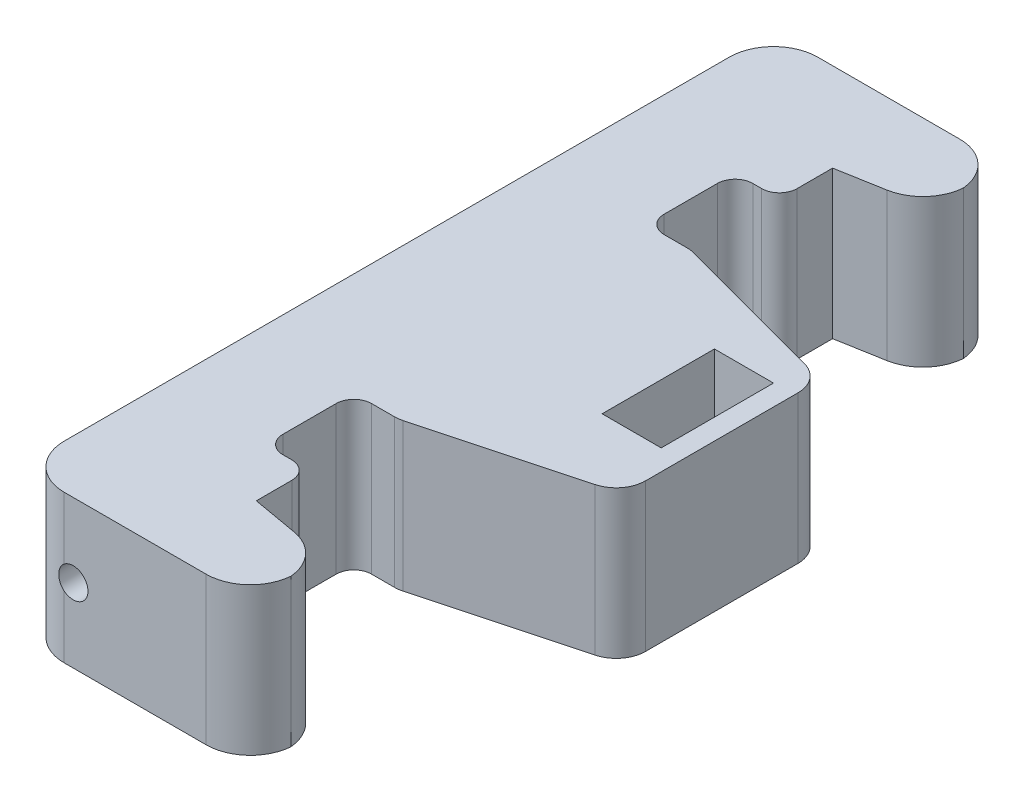
from build123d import *

# Parameters (mm, degrees)
BOSS_EXTRUDE1_DEPTH = 12.7
CUT_EXTRUDE1_DEPTH  = 38.486519244
FILLET4_R           = 1.524
FILLET5_R           = 3.81
SKETCH3_R           = 1.27
CUT_EXTRUDE2_DEPTH  = 68.465574925
SKETCH4_W           = 5.08
SKETCH4_H           = 9.652
CUT_EXTRUDE3_DEPTH  = 38.486519401
FILLET6_R           = 2.54


with BuildPart() as part:
    # Sketch1 → Boss-Extrude1 (new body)
    with BuildSketch(Plane(origin=(0, 0, 0), x_dir=(1, 0, 0), z_dir=(0, 1, 0))):
        Polygon((5.842, 32.385), (-13.97, 32.385), (-13.97, -32.385), (5.842, -32.385), (5.842, -24.765), (-1.27, -24.765), (-1.27, -20.193), (-5.08, -20.193), (-5.08, -12.573), (-1.27, -12.573), (5.842, -12.573), (13.97, -12.573), (13.97, 12.573), (5.842, 12.573), (-1.27, 12.573), (-5.08, 12.573), (-5.08, 20.193), (-1.27, 20.193), (-1.27, 24.765), (5.842, 24.765), align=None)
    extrude(amount=BOSS_EXTRUDE1_DEPTH)

    # Sketch2 → Cut-Extrude1 (cut, through all)
    with BuildSketch(Plane(origin=(0, 12.7, 0), x_dir=(1, 0, 0), z_dir=(0, 1, 0))):
        Polygon((-1.27, 24.765), (5.842, 26.019037487), (5.842, 24.765), align=None)
        Polygon((-1.27, -24.765), (5.842, -26.019037487), (5.842, -24.765), align=None)
        Polygon((-1.27, 12.573), (13.97, 8.489454307), (13.97, 12.573), align=None)
        Polygon((-1.27, -12.573), (13.97, -8.489454307), (13.97, -12.573), align=None)
    extrude(amount=-CUT_EXTRUDE1_DEPTH, mode=Mode.SUBTRACT)

    # Fillet4
    fillet4_edges = [part.edges().sort_by_distance(p)[0] for p in [
        (-5.08, 6.35, 20.193),
        (-1.27, 6.35, 20.193),
        (-1.27, 6.35, -20.193),
        (-5.08, 6.35, -20.193),
        (-5.08, 6.35, -12.573),
        (-5.08, 6.35, 12.573),
    ]]
    fillet(fillet4_edges, radius=FILLET4_R)

    # Fillet5
    # the kernel refuses this fillet: 3.81 mm, written as the material it takes off along each edge
    with BuildSketch(Plane(origin=(-13.97, -9.525, 32.385), x_dir=(0, 0, -1), z_dir=(0, 1, 0)), Plane(origin=(-13.97, -9.525, -32.385), x_dir=(1, 0, 0), z_dir=(0, 1, 0)), Plane(origin=(5.842, -9.525, -32.385), x_dir=(0, 0, 1), z_dir=(0, 1, 0)), Plane(origin=(5.842, -9.525, 32.385), x_dir=(-1, 0, 0), z_dir=(0, 1, 0))) as fillet5_piece_1:
        with BuildLine():
            CenterArc((FILLET5_R, -FILLET5_R), FILLET5_R, 90, 90)
            Line((0, -FILLET5_R), (0, 0))
            Line((0, 0), (FILLET5_R, 0))
        make_face()
    extrude(amount=31.75, mode=Mode.SUBTRACT)
    with BuildSketch(Plane(origin=(5.842, 20.692423987, -26.019037487), x_dir=(-0.9848077530122095, 0, 0.17364817766692292), z_dir=(0, -1, 0)), Plane(origin=(5.842, 20.692423987, 26.019037487), x_dir=(0, 0, 1), z_dir=(0, -1, 0))) as fillet5_piece_2:
        with BuildLine():
            CenterArc((FILLET5_R * 0.839099631177, FILLET5_R), FILLET5_R, 190, 80)
            Line((-FILLET5_R * 0.145708121835, FILLET5_R * 0.826351822333), (0, 0))
            Line((0, 0), (FILLET5_R * 0.839099631177, 0))
        make_face()
    extrude(amount=28.684847974, mode=Mode.SUBTRACT)

    # Sketch3 → Cut-Extrude2 (cut, through all)
    with BuildSketch(Plane.XY.offset(32.385)):
        with Locations(Location((-9.391956596, 6.35, 0), (0, 0, 127.211471896))):
            Circle(SKETCH3_R)
    extrude(amount=-CUT_EXTRUDE2_DEPTH, mode=Mode.SUBTRACT)

    # Sketch4 → Cut-Extrude3 (cut, through all)
    with BuildSketch(Plane(origin=(0, 12.7, 0), x_dir=(1, 0, 0), z_dir=(0, 1, 0))):
        with Locations((9.652, 1.397)):
            Rectangle(SKETCH4_W, SKETCH4_H)
    extrude(amount=-CUT_EXTRUDE3_DEPTH, mode=Mode.SUBTRACT)

    # Fillet6
    fillet6_edges = [part.edges().sort_by_distance(p)[0] for p in [
        (-1.27, 6.35, 12.573),
        (13.97, 6.35, 8.489454307),
        (-1.27, 6.35, -12.573),
        (13.97, 6.35, -8.489454307),
    ]]
    fillet(fillet6_edges, radius=FILLET6_R)


solid = part.part
